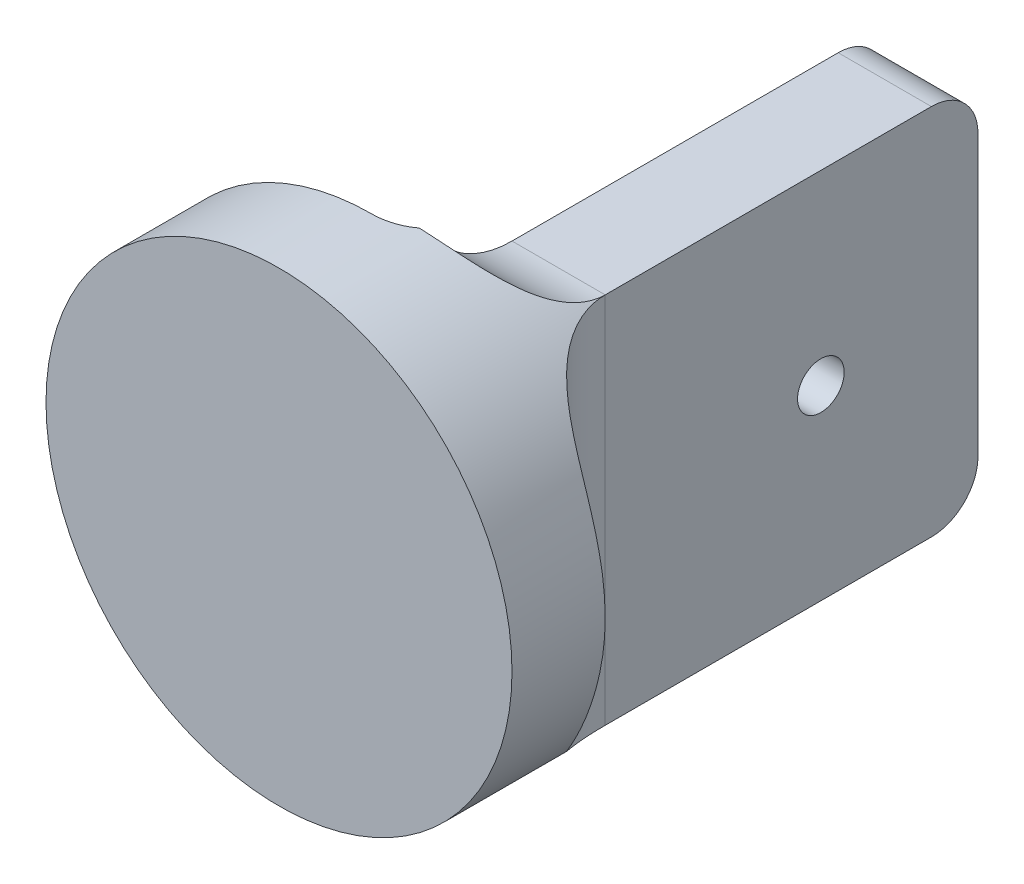
from build123d import *

# Parameters (mm, degrees)
SKETCH1_W           = 10
SKETCH1_H           = 40
BOSS_EXTRUDE1_DEPTH = 10
SKETCH2_W           = 10
SKETCH2_H           = 40
BOSS_EXTRUDE2_DEPTH = 50
FILLET1_R           = 10
FILLET2_R           = 10
FILLET3_R           = 5
SKETCH3_R           = 2.4999999999999982
CUT_EXTRUDE1_DEPTH  = 50


with BuildPart() as part:
    # Sketch1 → Boss-Extrude1 (new body)
    with BuildSketch(Plane.XY):
        with BuildLine():
            Line((15, -20), (5.000000000000001, -20))
            Line((5.000000000000001, -20), (5.000000000000001, 20))
            Line((5.000000000000001, 20), (15, 20))
            ThreePointArc((15.000000000000002, 20), (-25, 3.06e-15), (14.999999999999995, -20.000000000000004))
        make_face()
        with BuildLine():
            Line((15.000000000000002, 20), (15.000000000000002, -20))
            ThreePointArc((14.999999999999995, -20.000000000000004), (22.360679774997894, -11.180339887498954), (25, -6.12e-15))
            ThreePointArc((25, 0), (22.360679774997898, 11.180339887498947), (15.000000000000002, 20))
        make_face()
        with Locations((10.000000000000002, 0)):
            Rectangle(SKETCH1_W, SKETCH1_H)
    extrude(amount=BOSS_EXTRUDE1_DEPTH)

    # Sketch2 → Boss-Extrude2 (add)
    with BuildSketch(Plane(origin=(0, 0, 0), x_dir=(-1, 0, 0), z_dir=(0, 0, -1))):
        with Locations((-10.000000000000002, 0)):
            Rectangle(SKETCH2_W, SKETCH2_H)
    extrude(amount=BOSS_EXTRUDE2_DEPTH)

    # Fillet1
    # the kernel refuses this fillet: 10 mm, written as the material it adds along each edge
    with BuildSketch(Plane(origin=(15.000000000000002, 20, 0), x_dir=(1, 0, 0), z_dir=(0, -1, 0))) as fillet1_piece_1_section:
        with BuildLine():
            CenterArc((FILLET1_R, -FILLET1_R), FILLET1_R, 90, 90)
            Line((-1.78e-15, -FILLET1_R), (-FILLET1_R * 0.02, -FILLET1_R))
            Line((-FILLET1_R * 0.02, -FILLET1_R), (-FILLET1_R * 0.02, FILLET1_R * 0.02))
            Line((-FILLET1_R * 0.02, FILLET1_R * 0.02), (FILLET1_R, FILLET1_R * 0.02))
            Line((FILLET1_R, FILLET1_R * 0.02), (FILLET1_R, 0))
        make_face()
    fillet1_piece_1 = extrude(amount=40, mode=Mode.PRIVATE)
    fillet1_piece_1 = fillet1_piece_1 & Plane(origin=(0, 0, -2.4332556101224805), x_dir=(0.6000000000000001, 0.8, 0), z_dir=(0, 0, -1)) * Cylinder(25, 120, mode=Mode.PRIVATE)
    add(fillet1_piece_1)

    # Fillet2
    # the kernel refuses this fillet: 10 mm, written as the material it adds along each edge
    with BuildSketch(Plane(origin=(5.000000000000001, 20, 0), x_dir=(0, 0, -1), z_dir=(1, 0, 0))) as fillet2_piece_1_section:
        with BuildLine():
            CenterArc((FILLET2_R, FILLET2_R), FILLET2_R, 180, 90)
            Line((-1.78e-15, FILLET2_R), (0, 0))
            Line((0, 0), (FILLET2_R, 0))
        make_face()
    fillet2_piece_1 = extrude(amount=9.8, mode=Mode.PRIVATE)
    fillet2_piece_1 = fillet2_piece_1 & Plane(origin=(0, 0, -2.8273844983564325), x_dir=(0.6000000000000001, 0.8, 0), z_dir=(0, 0, -1)) * Cylinder(25, 60, mode=Mode.PRIVATE)
    add(fillet2_piece_1)
    with BuildSketch(Plane(origin=(14.8, -20, 0), x_dir=(0, 0, -1), z_dir=(-1, 0, 0))) as fillet2_piece_2_section:
        with BuildLine():
            CenterArc((FILLET2_R, FILLET2_R), FILLET2_R, 180, 90)
            Line((-1.78e-15, FILLET2_R), (0, 0))
            Line((0, 0), (FILLET2_R, 0))
        make_face()
    fillet2_piece_2 = extrude(amount=9.799999999999999, mode=Mode.PRIVATE)
    fillet2_piece_2 = fillet2_piece_2 & Plane(origin=(0, 0, -2.827384190918209), x_dir=(0.6000000000000001, 0.8, 0), z_dir=(0, 0, -1)) * Cylinder(25, 60, mode=Mode.PRIVATE)
    add(fillet2_piece_2)
    with BuildSketch(Plane(origin=(40, -20, 0), x_dir=(0, 0, -1), z_dir=(-1, 0, 0))) as fillet2_piece_3_section:
        with BuildLine():
            CenterArc((FILLET2_R, FILLET2_R), FILLET2_R, 180, 90)
            Line((-1.78e-15, FILLET2_R), (0, 0))
            Line((0, 0), (FILLET2_R, 0))
        make_face()
    fillet2_piece_3 = extrude(amount=25.2, mode=Mode.PRIVATE)
    fillet2_piece_3 = fillet2_piece_3 & Plane(origin=(0, 0, -4.548731102364826), x_dir=(0.6, 0.8, 0), z_dir=(0, 0, -1)) * Cylinder(25, 91, mode=Mode.PRIVATE)
    add(fillet2_piece_3)
    with BuildSketch(Plane(origin=(14.8, 20, 0), x_dir=(0, 0, -1), z_dir=(1, 0, 0))) as fillet2_piece_4_section:
        with BuildLine():
            CenterArc((FILLET2_R, FILLET2_R), FILLET2_R, 180, 90)
            Line((-1.78e-15, FILLET2_R), (0, 0))
            Line((0, 0), (FILLET2_R, 0))
        make_face()
    fillet2_piece_4 = extrude(amount=25.2, mode=Mode.PRIVATE)
    fillet2_piece_4 = fillet2_piece_4 & Plane(origin=(0, 0, -4.548731089357503), x_dir=(0.6, 0.8, 0), z_dir=(0, 0, -1)) * Cylinder(25, 91, mode=Mode.PRIVATE)
    add(fillet2_piece_4)

    # Fillet3
    # the kernel refuses this fillet: 5 mm, written as the material it adds along each edge
    with BuildSketch(Plane(origin=(5, -36.99489742783178, 0), x_dir=(-1, 0, 0), z_dir=(0, 1, 0))) as fillet3_piece_1_section:
        with BuildLine():
            CenterArc((FILLET3_R, -FILLET3_R), FILLET3_R, 90, 90)
            Line((-8.9e-16, -FILLET3_R), (0, 0))
            Line((0, 0), (FILLET3_R, 0))
        make_face()
    fillet3_piece_1 = extrude(amount=73.98979485566356, mode=Mode.PRIVATE)
    fillet3_piece_1 = fillet3_piece_1 - Plane(origin=(3.8491362999010033, 30, -10), x_dir=(0, 0, -1), z_dir=(-1, 0, 0)) * Cylinder(10, 168, mode=Mode.PRIVATE)
    fillet3_piece_1 = fillet3_piece_1 & Plane(origin=(0, 0, -1.1013150030841163), x_dir=(0.6000000000000001, 0.8, 0), z_dir=(0, 0, -1)) * Cylinder(25, 168, mode=Mode.PRIVATE)
    fillet3_piece_1 = fillet3_piece_1 - Plane(origin=(3.849136299901005, -30, -10), x_dir=(0, 0, -1), z_dir=(1, 0, 0)) * Cylinder(10, 168, mode=Mode.PRIVATE)
    add(fillet3_piece_1)
    # the kernel refuses this fillet: 5 mm, written as the material it takes off along each edge
    with BuildSketch(Plane(origin=(27.5, -20, -50), x_dir=(0, 1, 0), z_dir=(-1, 0, 0))) as fillet3_2_piece_1:
        with BuildLine():
            CenterArc((FILLET3_R, -FILLET3_R), FILLET3_R, 90, 90)
            Line((0, -FILLET3_R), (0, 0))
            Line((0, 0), (FILLET3_R, 0))
        make_face()
    extrude(amount=35, mode=Mode.SUBTRACT)
    with BuildSketch(Plane(origin=(-7.499999999999999, 20, -50), x_dir=(0, 0, 1), z_dir=(1, 0, 0))) as fillet3_2_piece_2:
        with BuildLine():
            CenterArc((FILLET3_R, FILLET3_R), FILLET3_R, 180, 90)
            Line((0, FILLET3_R), (0, 0))
            Line((0, 0), (FILLET3_R, 0))
        make_face()
    extrude(amount=35, mode=Mode.SUBTRACT)

    # Sketch3 → Cut-Extrude1 (cut)
    with BuildSketch(Plane.ZY.offset(-5.000000000000001)):
        with Locations((-33.14088712721044, 0)):
            Circle(SKETCH3_R)
    extrude(amount=-CUT_EXTRUDE1_DEPTH, mode=Mode.SUBTRACT)


solid = part.part
